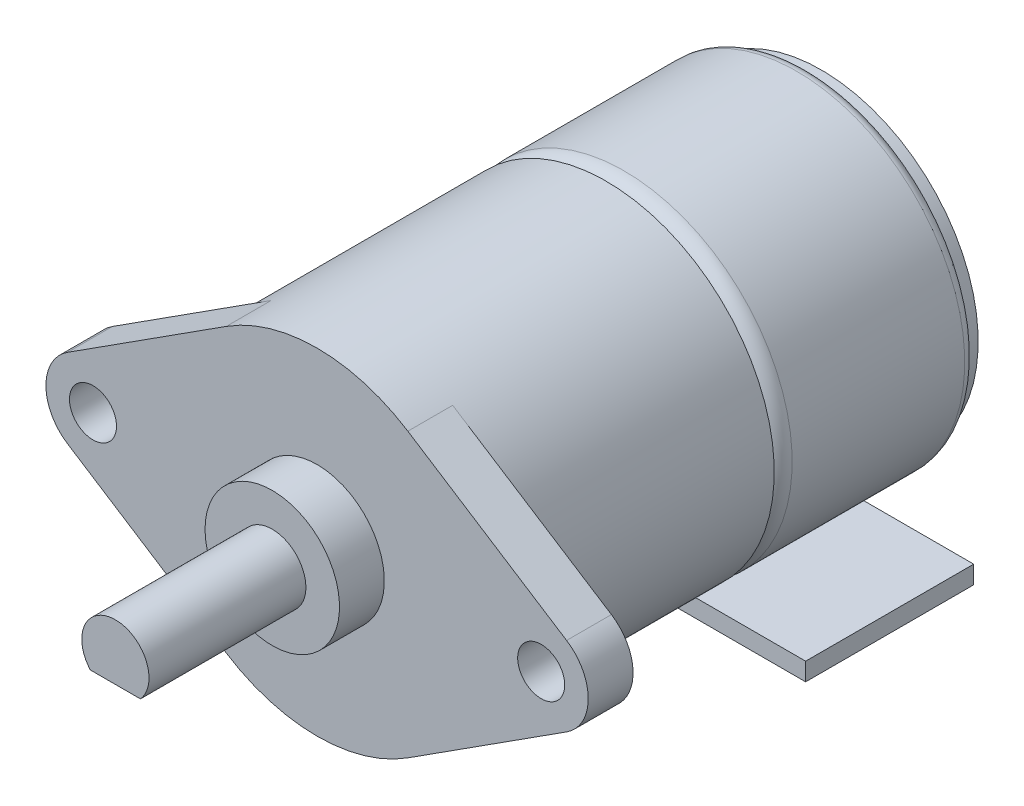
from build123d import *

# Parameters (mm, degrees)
CUT_EXTRUDE_1354_DEPTH       = 6.5
SKETCH_3_R                   = 1.05
EXTRUDE_1763_DEPTH           = 2
SKETCH_4_W                   = 11.5
SKETCH_4_H                   = 7.5
EXTRUDE_2006_DEPTH           = 0.8
SKETCH_2045_R                = 0.75
EXTRUDE_2480_DEPTH           = 0.7
EXTRUDE_2480_DRAFT           = 35
EXTRUDE_2480_PROFILE_2_DEPTH = 0.7
EXTRUDE_2480_PROFILE_2_DRAFT = 35
EXTRUDE_2480_PROFILE_3_DEPTH = 0.7
EXTRUDE_2480_PROFILE_3_DRAFT = 35
EXTRUDE_2480_PROFILE_4_DEPTH = 0.7
EXTRUDE_2480_PROFILE_4_DRAFT = 35
EXTRUDE_2480_PROFILE_5_DEPTH = 0.7
EXTRUDE_2480_PROFILE_5_DRAFT = 35
EXTRUDE_2480_PROFILE_6_DEPTH = 0.7
EXTRUDE_2480_PROFILE_6_DRAFT = 35
EXTRUDE_2480_PROFILE_7_DEPTH = 0.7
EXTRUDE_2480_PROFILE_7_DRAFT = 35
EXTRUDE_2480_PROFILE_8_DEPTH = 0.7
EXTRUDE_2480_PROFILE_8_DRAFT = 35
EXTRUDE_2791_DEPTH           = 0.01


with BuildPart() as part:
    # Эскиз1 → Motor (revolve)
    with BuildSketch(Plane(origin=(0, 0, 0), x_dir=(1, 0, 0), z_dir=(0, 1, 0))):
        with BuildLine():
            Line((-0.75, -0.5), (-3, -0.5))
            Line((-3, -0.5), (-3, -1.5))
            Line((-3, -1.5), (-7, -1.5))
            Line((-7, -1.5), (-7, -2.1))
            ThreePointArc((-7, -2.1), (-7.353553391, -2.246446609), (-7.5, -2.6))
            Line((-7.5, -2.6), (-7.5, -10.3))
            ThreePointArc((-7.5, -10.3), (-7.265685425, -10.865685425), (-6.7, -11.1))
            Line((-6.7, -11.1), (-7.5, -11.1))
            Line((-7.5, -11.1), (-7.5, -24))
            Line((-7.5, -24), (-3, -24))
            Line((-3, -24), (-3, -26))
            Line((-3, -26), (-1.5, -26))
            Line((-1.5, -26), (-1.5, -33))
            Line((-1.5, -33), (0, -33))
            Line((0, -33), (0, -12))
            Line((0, -12), (0, 0))
            Line((0, 0), (-0.5, 0))
            ThreePointArc((-0.5, 0), (-0.676776695, -0.073223305), (-0.75, -0.25))
            Line((-0.75, -0.25), (-0.75, -0.5))
        make_face()
    revolve(axis=Axis((0, 0, 0), (0, 0, 1)))

    # Эскиз2 → Cut-Extrude 1354 (cut)
    with BuildSketch(Plane.XY.offset(33)):
        with BuildLine():
            Line((-1.5, -2), (1.5, -2))
            ThreePointArc((1.5, -2), (0, 2.5), (-1.5, -2))
        make_face()
        with BuildLine():
            Line((-1.118033989, -1), (1.118033989, -1))
            ThreePointArc((1.118033989, -1), (0, 1.5), (-1.118033989, -1))
        make_face(mode=Mode.SUBTRACT)
    extrude(amount=-CUT_EXTRUDE_1354_DEPTH, mode=Mode.SUBTRACT)

    # Эскиз3 → Extrude 1763 (add)
    with BuildSketch(Plane.XY.offset(24)):
        with BuildLine():
            Line((4.05, 6.312487624), (11.134, 1.767496535))
            ThreePointArc((11.134, 1.767496535), (12.1, 0), (11.134, -1.767496535))
            Line((11.134, -1.767496535), (4.05, -6.312487624))
            ThreePointArc((4.05, -6.312487624), (0, -7.5), (-4.05, -6.312487624))
            Line((-4.05, -6.312487624), (-11.134, -1.767496535))
            ThreePointArc((-11.134, -1.767496535), (-12.1, 0), (-11.134, 1.767496535))
            Line((-11.134, 1.767496535), (-4.05, 6.312487624))
            ThreePointArc((-4.05, 6.312487624), (0, 7.5), (4.05, 6.312487624))
        make_face()
        with Locations((10, 0)):
            Circle(SKETCH_3_R, mode=Mode.SUBTRACT)
        with Locations((-10, 0)):
            Circle(SKETCH_3_R, mode=Mode.SUBTRACT)
    extrude(amount=-EXTRUDE_1763_DEPTH)


with BuildPart() as body_2:
    # Эскиз4 → Extrude 2006 (new body)
    with BuildSketch(Plane(origin=(0, -7.5, 0), x_dir=(-1, 0, 0), z_dir=(0, -1, 0))):
        with Locations((-2.25, -6.45)):
            Rectangle(SKETCH_4_W, SKETCH_4_H)
    extrude(amount=EXTRUDE_2006_DEPTH)


with BuildPart() as extrude_2480_tool:
    # Sketch 2045 → Extrude 2480 (with draft: the straight prism first)
    with BuildSketch(Plane.XZ.offset(8.3)):
        with Locations((-2.25, 5.7)):
            Circle(SKETCH_2045_R)
    extrude(amount=EXTRUDE_2480_DEPTH)
    # Extrude 2480: the draft: its side faces are tilted about the plane it starts from
    extrude_2480_sides = [extrude_2480_tool.faces().sort_by_distance(p)[0] for p in [
        (-3, -8.65, 5.7),
    ]]
    draft(extrude_2480_sides, Plane.XZ.offset(8.3), EXTRUDE_2480_DRAFT)


with BuildPart() as body_2_1:
    add(body_2.part)

    # Extrude 2480: add extrude_2480_tool
    add(extrude_2480_tool.part)


with BuildPart() as extrude_2480_profile_2_tool:
    # Sketch 2045 → Extrude 2480 profile 2 (with draft: the straight prism first)
    with BuildSketch(Plane.XZ.offset(8.3)):
        with Locations((-0.75, 7.2)):
            Circle(SKETCH_2045_R)
    extrude(amount=EXTRUDE_2480_PROFILE_2_DEPTH)
    # Extrude 2480 profile 2: the draft: its side faces are tilted about the plane it starts from
    extrude_2480_profile_2_sides = [extrude_2480_profile_2_tool.faces().sort_by_distance(p)[0] for p in [
        (-1.5, -8.65, 7.2),
    ]]
    draft(extrude_2480_profile_2_sides, Plane.XZ.offset(8.3), EXTRUDE_2480_PROFILE_2_DRAFT)


with BuildPart() as body_2_2:
    add(body_2_1.part)

    # Extrude 2480 profile 2: add extrude_2480_profile_2_tool
    add(extrude_2480_profile_2_tool.part)


with BuildPart() as extrude_2480_profile_3_tool:
    # Sketch 2045 → Extrude 2480 profile 3 (with draft: the straight prism first)
    with BuildSketch(Plane.XZ.offset(8.3)):
        with Locations((0.75, 5.7)):
            Circle(SKETCH_2045_R)
    extrude(amount=EXTRUDE_2480_PROFILE_3_DEPTH)
    # Extrude 2480 profile 3: the draft: its side faces are tilted about the plane it starts from
    extrude_2480_profile_3_sides = [extrude_2480_profile_3_tool.faces().sort_by_distance(p)[0] for p in [
        (0, -8.65, 5.7),
    ]]
    draft(extrude_2480_profile_3_sides, Plane.XZ.offset(8.3), EXTRUDE_2480_PROFILE_3_DRAFT)


with BuildPart() as body_2_3:
    add(body_2_2.part)

    # Extrude 2480 profile 3: add extrude_2480_profile_3_tool
    add(extrude_2480_profile_3_tool.part)


with BuildPart() as extrude_2480_profile_4_tool:
    # Sketch 2045 → Extrude 2480 profile 4 (with draft: the straight prism first)
    with BuildSketch(Plane.XZ.offset(8.3)):
        with Locations((2.25, 7.2)):
            Circle(SKETCH_2045_R)
    extrude(amount=EXTRUDE_2480_PROFILE_4_DEPTH)
    # Extrude 2480 profile 4: the draft: its side faces are tilted about the plane it starts from
    extrude_2480_profile_4_sides = [extrude_2480_profile_4_tool.faces().sort_by_distance(p)[0] for p in [
        (1.5, -8.65, 7.2),
    ]]
    draft(extrude_2480_profile_4_sides, Plane.XZ.offset(8.3), EXTRUDE_2480_PROFILE_4_DRAFT)


with BuildPart() as body_2_4:
    add(body_2_3.part)

    # Extrude 2480 profile 4: add extrude_2480_profile_4_tool
    add(extrude_2480_profile_4_tool.part)


with BuildPart() as extrude_2480_profile_5_tool:
    # Sketch 2045 → Extrude 2480 profile 5 (with draft: the straight prism first)
    with BuildSketch(Plane.XZ.offset(8.3)):
        with Locations((7, 3.7)):
            Circle(SKETCH_2045_R)
    extrude(amount=EXTRUDE_2480_PROFILE_5_DEPTH)
    # Extrude 2480 profile 5: the draft: its side faces are tilted about the plane it starts from
    extrude_2480_profile_5_sides = [extrude_2480_profile_5_tool.faces().sort_by_distance(p)[0] for p in [
        (6.25, -8.65, 3.7),
    ]]
    draft(extrude_2480_profile_5_sides, Plane.XZ.offset(8.3), EXTRUDE_2480_PROFILE_5_DRAFT)


with BuildPart() as body_2_5:
    add(body_2_4.part)

    # Extrude 2480 profile 5: add extrude_2480_profile_5_tool
    add(extrude_2480_profile_5_tool.part)


with BuildPart() as extrude_2480_profile_6_tool:
    # Sketch 2045 → Extrude 2480 profile 6 (with draft: the straight prism first)
    with BuildSketch(Plane.XZ.offset(8.3)):
        with Locations((7, 5.533333333)):
            Circle(SKETCH_2045_R)
    extrude(amount=EXTRUDE_2480_PROFILE_6_DEPTH)
    # Extrude 2480 profile 6: the draft: its side faces are tilted about the plane it starts from
    extrude_2480_profile_6_sides = [extrude_2480_profile_6_tool.faces().sort_by_distance(p)[0] for p in [
        (6.25, -8.65, 5.533333333),
    ]]
    draft(extrude_2480_profile_6_sides, Plane.XZ.offset(8.3), EXTRUDE_2480_PROFILE_6_DRAFT)


with BuildPart() as body_2_6:
    add(body_2_5.part)

    # Extrude 2480 profile 6: add extrude_2480_profile_6_tool
    add(extrude_2480_profile_6_tool.part)


with BuildPart() as extrude_2480_profile_7_tool:
    # Sketch 2045 → Extrude 2480 profile 7 (with draft: the straight prism first)
    with BuildSketch(Plane.XZ.offset(8.3)):
        with Locations((7, 7.366666667)):
            Circle(SKETCH_2045_R)
    extrude(amount=EXTRUDE_2480_PROFILE_7_DEPTH)
    # Extrude 2480 profile 7: the draft: its side faces are tilted about the plane it starts from
    extrude_2480_profile_7_sides = [extrude_2480_profile_7_tool.faces().sort_by_distance(p)[0] for p in [
        (6.25, -8.65, 7.366666667),
    ]]
    draft(extrude_2480_profile_7_sides, Plane.XZ.offset(8.3), EXTRUDE_2480_PROFILE_7_DRAFT)


with BuildPart() as body_2_7:
    add(body_2_6.part)

    # Extrude 2480 profile 7: add extrude_2480_profile_7_tool
    add(extrude_2480_profile_7_tool.part)


with BuildPart() as extrude_2480_profile_8_tool:
    # Sketch 2045 → Extrude 2480 profile 8 (with draft: the straight prism first)
    with BuildSketch(Plane.XZ.offset(8.3)):
        with Locations((7, 9.2)):
            Circle(SKETCH_2045_R)
    extrude(amount=EXTRUDE_2480_PROFILE_8_DEPTH)
    # Extrude 2480 profile 8: the draft: its side faces are tilted about the plane it starts from
    extrude_2480_profile_8_sides = [extrude_2480_profile_8_tool.faces().sort_by_distance(p)[0] for p in [
        (6.25, -8.65, 9.2),
    ]]
    draft(extrude_2480_profile_8_sides, Plane.XZ.offset(8.3), EXTRUDE_2480_PROFILE_8_DRAFT)


with BuildPart() as body_2_8:
    add(body_2_7.part)

    # Extrude 2480 profile 8: add extrude_2480_profile_8_tool
    add(extrude_2480_profile_8_tool.part)

    # Эскиз6 → Extrude 2791 (add)
    # profile 1 of 16: a face of its own
    with BuildSketch(Plane.XZ.offset(8.3)):
        with BuildLine():
            Line((5.183226347, 9.305128205), (5.183226347, 9.228846154))
            add(Edge.make_bspline(
                [(5.183226347, 9.228846154), (5.173106274, 9.22934332), (5.153230721, 9.23031974), (5.124252058, 9.234892324), (5.096553035, 9.241435109), (5.070356056, 9.250685891), (5.045429488, 9.262174558), (5.021872342, 9.27595185), (4.999774482, 9.292270357), (4.979340763, 9.310777707), (4.96059521, 9.330878662), (4.944407508, 9.352567247), (4.930730359, 9.375358182), (4.919296343, 9.399182322), (4.910713809, 9.424308459), (4.904345697, 9.450508582), (4.900514298, 9.4778978), (4.900102465, 9.496558949), (4.899893013, 9.506049679)],
                knots=[0, 0, 0, 0, 1.10065271, 2.161652631, 3.183658789, 4.190468796, 5.17591951, 6.163126047, 7.15150782, 8.156236427, 9.156009102, 10.134482811, 11.092018607, 12.041330605, 13.001268258, 13.972401359, 14.968799086, 16, 16, 16, 16], degree=3))
            add(Edge.make_bspline(
                [(4.899893013, 9.506049679), (4.900109439, 9.515370725), (4.900534708, 9.533686246), (4.904241722, 9.560406313), (4.909922389, 9.585903666), (4.918340243, 9.609889343), (4.928902809, 9.632609504), (4.942038744, 9.653782836), (4.957126498, 9.673921332), (4.974923245, 9.69203663), (4.993912419, 9.708677717), (5.014192696, 9.723021328), (5.035163128, 9.735374158), (5.056987523, 9.745484564), (5.079736952, 9.753148701), (5.10319331, 9.758827092), (5.127627297, 9.762073168), (5.144167936, 9.762568621), (5.152577308, 9.762820513)],
                knots=[0, 0, 0, 0, 1.111674182, 2.184400057, 3.212814286, 4.223731311, 5.211378316, 6.196328225, 7.191884489, 8.207283132, 9.220262353, 10.201199469, 11.166417575, 12.120932471, 13.06540007, 14.026332106, 14.996573967, 16, 16, 16, 16], degree=3))
            add(Edge.make_bspline(
                [(5.152577308, 9.762820513), (5.164416063, 9.762409285), (5.187885819, 9.761594047), (5.222375218, 9.75462065), (5.255790478, 9.743728994), (5.282684739, 9.730616512), (5.304353679, 9.717384889), (5.322203622, 9.705473201), (5.341418154, 9.691449296), (5.362075046, 9.675432988), (5.383903778, 9.657148454), (5.407349714, 9.637070722), (5.431979324, 9.614681279), (5.448812639, 9.598980897), (5.457535241, 9.590845353)],
                knots=[0, 0, 0, 0, 1.184416499, 2.348048165, 3.509039915, 4.696071444, 5.333504901, 6.05069495, 6.844171097, 7.714965912, 8.667477798, 9.695072654, 10.805644396, 12, 12, 12, 12], degree=3))
            Line((5.457535241, 9.590845353), (5.684508398, 9.37817508))
            Line((5.684508398, 9.37817508), (5.684508398, 9.773717949))
            Line((5.684508398, 9.773717949), (5.771687885, 9.773717949))
            Line((5.771687885, 9.773717949), (5.771687885, 9.196153846))
            Line((5.771687885, 9.196153846), (5.419905033, 9.525801282))
            add(Edge.make_bspline(
                [(5.419905033, 9.525801282), (5.411526873, 9.533827197), (5.395434141, 9.549243338), (5.371939423, 9.571047678), (5.350143106, 9.590631433), (5.330086372, 9.608121371), (5.311475849, 9.623138079), (5.294914278, 9.636464193), (5.279673911, 9.647141551), (5.262008334, 9.658729575), (5.240439628, 9.669952971), (5.214081446, 9.6795974), (5.186947685, 9.685478149), (5.168611476, 9.686183609), (5.159388206, 9.686538462)],
                knots=[0, 0, 0, 0, 1.329631726, 2.553950428, 3.673215718, 4.687767853, 5.603093632, 6.413772471, 7.123043292, 7.734684054, 8.834405432, 9.900288307, 10.943827018, 12, 12, 12, 12], degree=3))
            add(Edge.make_bspline(
                [(5.159388206, 9.686538462), (5.153588438, 9.686384067), (5.142158208, 9.686079785), (5.125399667, 9.683394344), (5.109233926, 9.679336078), (5.093611262, 9.673520801), (5.078688746, 9.665844879), (5.064448215, 9.656501344), (5.050680895, 9.6457209), (5.037772237, 9.633249877), (5.025949658, 9.619549937), (5.015476666, 9.605077047), (5.006724311, 9.589764879), (4.999549462, 9.573677992), (4.993921155, 9.556861236), (4.990021214, 9.539282083), (4.987572611, 9.520989108), (4.987241312, 9.508498116), (4.987072501, 9.502133413)],
                knots=[0, 0, 0, 0, 0.991446411, 1.95395049, 2.89581595, 3.838931463, 4.798493298, 5.75982156, 6.748411868, 7.785213223, 8.824556874, 9.840280684, 10.836137867, 11.835679398, 12.848801643, 13.863922112, 14.911575587, 16, 16, 16, 16], degree=3))
            add(Edge.make_bspline(
                [(4.987072501, 9.502133413), (4.987239299, 9.495484543), (4.987566864, 9.482427259), (4.990048006, 9.463296967), (4.993809418, 9.444921487), (4.999783361, 9.427574998), (5.006841872, 9.410881872), (5.015808949, 9.395198482), (5.026228891, 9.380264435), (5.03831124, 9.366325367), (5.051886632, 9.353594562), (5.066847651, 9.342251598), (5.08308659, 9.332405907), (5.1005368, 9.323803635), (5.119372022, 9.316820921), (5.139521114, 9.311484355), (5.160897794, 9.307261899), (5.175659878, 9.305851249), (5.183226347, 9.305128205)],
                knots=[0, 0, 0, 0, 1.030878251, 2.024474673, 2.987898669, 3.934362936, 4.864849709, 5.795128259, 6.730474222, 7.685293701, 8.650606017, 9.611896181, 10.591709709, 11.591680886, 12.625074257, 13.701333388, 14.821793024, 16, 16, 16, 16], degree=3))
        make_face()
    # profile 2 of 16: a face of its own
    with BuildSketch(Plane.XZ.offset(8.3)):
        Polygon((4.921687885, 8.749358974), (5.771687885, 9.141666667), (5.771687885, 9.05874399), (5.499251988, 8.933082933), (5.499251988, 8.54775641), (5.771687885, 8.418519631), (5.771687885, 8.33525641), (4.921687885, 8.738461538), align=None)
        Polygon((5.087362965, 8.743058894), (5.412072501, 8.589132612), (5.412072501, 8.892898638), align=None, mode=Mode.SUBTRACT)
    # profile 3 of 16: a face of its own
    with BuildSketch(Plane.XZ.offset(8.3)):
        Polygon((4.921687885, 7.524248798), (4.921687885, 7.681410256), (5.771687885, 7.681410256), (5.771687885, 7.605128205), (5.008867372, 7.605128205), (5.008867372, 7.474358974), align=None)
    # profile 4 of 16: a face of its own
    with BuildSketch(Plane.XZ.offset(8.3)):
        Polygon((4.921687885, 6.896794872), (5.771687885, 7.289102564), (5.771687885, 7.206179888), (5.499251988, 7.08051883), (5.499251988, 6.695192308), (5.771687885, 6.565955529), (5.771687885, 6.482692308), (4.921687885, 6.885897436), align=None)
        Polygon((5.087362965, 6.890494792), (5.412072501, 6.73656851), (5.412072501, 7.040334535), align=None, mode=Mode.SUBTRACT)
    # profile 5 of 16: a face of its own
    with BuildSketch(Plane.XZ.offset(8.3)):
        with BuildLine():
            Line((5.183226347, 5.6), (5.183226347, 5.523717949))
            add(Edge.make_bspline(
                [(5.183226347, 5.523717949), (5.173106274, 5.524215114), (5.153230721, 5.525191535), (5.124252058, 5.529764119), (5.096553035, 5.536306904), (5.070356056, 5.545557685), (5.045429488, 5.557046353), (5.021872342, 5.570823645), (4.999774482, 5.587142152), (4.979340763, 5.605649501), (4.96059521, 5.625750457), (4.944407508, 5.647439042), (4.930730359, 5.670229977), (4.919296343, 5.694054117), (4.910713809, 5.719180254), (4.904345697, 5.745380376), (4.900514298, 5.772769595), (4.900102465, 5.791430743), (4.899893013, 5.800921474)],
                knots=[0, 0, 0, 0, 1.10065271, 2.161652631, 3.183658789, 4.190468796, 5.17591951, 6.163126047, 7.15150782, 8.156236427, 9.156009102, 10.134482811, 11.092018607, 12.041330605, 13.001268258, 13.972401359, 14.968799086, 16, 16, 16, 16], degree=3))
            add(Edge.make_bspline(
                [(4.899893013, 5.800921474), (4.900109439, 5.81024252), (4.900534708, 5.828558041), (4.904241722, 5.855278108), (4.909922389, 5.880775461), (4.918340243, 5.904761137), (4.928902809, 5.927481298), (4.942038744, 5.94865463), (4.957126498, 5.968793127), (4.974923245, 5.986908425), (4.993912419, 6.003549512), (5.014192696, 6.017893123), (5.035163128, 6.030245953), (5.056987523, 6.040356359), (5.079736952, 6.048020496), (5.10319331, 6.053698887), (5.127627297, 6.056944963), (5.144167936, 6.057440416), (5.152577308, 6.057692308)],
                knots=[0, 0, 0, 0, 1.111674182, 2.184400057, 3.212814286, 4.223731311, 5.211378316, 6.196328225, 7.191884489, 8.207283132, 9.220262353, 10.201199469, 11.166417575, 12.120932471, 13.06540007, 14.026332106, 14.996573967, 16, 16, 16, 16], degree=3))
            add(Edge.make_bspline(
                [(5.152577308, 6.057692308), (5.164416063, 6.05728108), (5.187885819, 6.056465842), (5.222375218, 6.049492445), (5.255790478, 6.038600789), (5.282684739, 6.025488307), (5.304353679, 6.012256684), (5.322203622, 6.000344996), (5.341418154, 5.986321091), (5.362075046, 5.970304783), (5.383903778, 5.952020248), (5.407349714, 5.931942517), (5.431979324, 5.909553074), (5.448812639, 5.893852692), (5.457535241, 5.885717147)],
                knots=[0, 0, 0, 0, 1.184416499, 2.348048165, 3.509039915, 4.696071444, 5.333504901, 6.05069495, 6.844171097, 7.714965912, 8.667477798, 9.695072654, 10.805644396, 12, 12, 12, 12], degree=3))
            Line((5.457535241, 5.885717147), (5.684508398, 5.673046875))
            Line((5.684508398, 5.673046875), (5.684508398, 6.068589744))
            Line((5.684508398, 6.068589744), (5.771687885, 6.068589744))
            Line((5.771687885, 6.068589744), (5.771687885, 5.491025641))
            Line((5.771687885, 5.491025641), (5.419905033, 5.820673077))
            add(Edge.make_bspline(
                [(5.419905033, 5.820673077), (5.411526873, 5.828698992), (5.395434141, 5.844115133), (5.371939423, 5.865919473), (5.350143106, 5.885503228), (5.330086372, 5.902993166), (5.311475849, 5.918009874), (5.294914278, 5.931335988), (5.279673911, 5.942013346), (5.262008334, 5.95360137), (5.240439628, 5.964824766), (5.214081446, 5.974469195), (5.186947685, 5.980349944), (5.168611476, 5.981055404), (5.159388206, 5.981410256)],
                knots=[0, 0, 0, 0, 1.329631726, 2.553950428, 3.673215718, 4.687767853, 5.603093632, 6.413772471, 7.123043292, 7.734684054, 8.834405432, 9.900288307, 10.943827018, 12, 12, 12, 12], degree=3))
            add(Edge.make_bspline(
                [(5.159388206, 5.981410256), (5.153588438, 5.981255862), (5.142158208, 5.98095158), (5.125399667, 5.978266139), (5.109233926, 5.974207873), (5.093611262, 5.968392596), (5.078688746, 5.960716674), (5.064448215, 5.951373139), (5.050680895, 5.940592695), (5.037772237, 5.928121672), (5.025949658, 5.914421732), (5.015476666, 5.899948842), (5.006724311, 5.884636674), (4.999549462, 5.868549787), (4.993921155, 5.85173303), (4.990021214, 5.834153878), (4.987572611, 5.815860903), (4.987241312, 5.803369911), (4.987072501, 5.797005208)],
                knots=[0, 0, 0, 0, 0.991446411, 1.95395049, 2.89581595, 3.838931463, 4.798493298, 5.75982156, 6.748411868, 7.785213223, 8.824556874, 9.840280684, 10.836137867, 11.835679398, 12.848801643, 13.863922112, 14.911575587, 16, 16, 16, 16], degree=3))
            add(Edge.make_bspline(
                [(4.987072501, 5.797005208), (4.987239299, 5.790356338), (4.987566864, 5.777299054), (4.990048006, 5.758168762), (4.993809418, 5.739793282), (4.999783361, 5.722446793), (5.006841872, 5.705753667), (5.015808949, 5.690070277), (5.026228891, 5.67513623), (5.03831124, 5.661197162), (5.051886632, 5.648466356), (5.066847651, 5.637123393), (5.08308659, 5.627277702), (5.1005368, 5.61867543), (5.119372022, 5.611692716), (5.139521114, 5.606356149), (5.160897794, 5.602133694), (5.175659878, 5.600723044), (5.183226347, 5.6)],
                knots=[0, 0, 0, 0, 1.030878251, 2.024474673, 2.987898669, 3.934362936, 4.864849709, 5.795128259, 6.730474222, 7.685293701, 8.650606017, 9.611896181, 10.591709709, 11.591680886, 12.625074257, 13.701333388, 14.821793024, 16, 16, 16, 16], degree=3))
        make_face()
    # profile 6 of 16: a face of its own
    with BuildSketch(Plane.XZ.offset(8.3)):
        with BuildLine():
            Line((4.921687885, 4.891666667), (4.921687885, 5.057512019))
            add(Edge.make_bspline(
                [(4.921687885, 5.057512019), (4.921729896, 5.065630492), (4.921811322, 5.081366113), (4.9231035, 5.104246237), (4.924821328, 5.125684119), (4.927702893, 5.145641874), (4.930690696, 5.164249365), (4.935076075, 5.181317687), (4.939919886, 5.196989808), (4.947372746, 5.215808817), (4.958947132, 5.237161562), (4.976113047, 5.260111768), (4.996693592, 5.280061486), (5.020146747, 5.297024661), (5.045947875, 5.310637969), (5.073541857, 5.320362002), (5.102464456, 5.326609091), (5.122293572, 5.327243488), (5.132314888, 5.327564103)],
                knots=[0, 0, 0, 0, 1.00128172, 1.940733171, 2.826250472, 3.653024905, 4.427672124, 5.149348099, 5.824709082, 6.450061444, 7.643590664, 8.808605388, 9.972104426, 11.165284501, 12.367876273, 13.557044126, 14.765369432, 16, 16, 16, 16], degree=3))
            add(Edge.make_bspline(
                [(5.132314888, 5.327564103), (5.141701525, 5.327297054), (5.160147151, 5.326772279), (5.187079484, 5.321815329), (5.212690558, 5.313947941), (5.236958454, 5.303074894), (5.259431423, 5.28906558), (5.28003985, 5.272280453), (5.29800485, 5.252113258), (5.308044519, 5.23699586), (5.313144215, 5.229316907)],
                knots=[0, 0, 0, 0, 1.044641374, 2.052818814, 3.038628718, 4.023282556, 5.005660861, 5.98021751, 6.974042014, 8, 8, 8, 8], degree=3))
            add(Edge.make_bspline(
                [(5.313144215, 5.229316907), (5.31685263, 5.238972078), (5.323947745, 5.257444813), (5.336472213, 5.282880656), (5.350143866, 5.304715331), (5.364843335, 5.323375369), (5.380921481, 5.33925023), (5.39850893, 5.352998779), (5.417591286, 5.364884666), (5.438098413, 5.374999475), (5.459856464, 5.382944783), (5.482599686, 5.388784474), (5.506240892, 5.392238779), (5.522284288, 5.392709999), (5.530411844, 5.392948718)],
                knots=[0, 0, 0, 0, 1.272586185, 2.434772614, 3.483318042, 4.437947805, 5.351807173, 6.25737843, 7.180033415, 8.1141739, 9.066731021, 10.025721652, 10.999834114, 12, 12, 12, 12], degree=3))
            add(Edge.make_bspline(
                [(5.530411844, 5.392948718), (5.538709546, 5.392711536), (5.555035509, 5.392244873), (5.579018416, 5.388800425), (5.601939819, 5.382972364), (5.623937413, 5.374930785), (5.644965078, 5.36450756), (5.664946637, 5.351639506), (5.683923663, 5.336507263), (5.701929646, 5.319405383), (5.718405686, 5.300346676), (5.732569525, 5.279342753), (5.744748407, 5.256969021), (5.754664019, 5.232939453), (5.762313907, 5.20731539), (5.767643775, 5.180111092), (5.771241058, 5.151371361), (5.771536416, 5.131648848), (5.771687885, 5.121534455)],
                knots=[0, 0, 0, 0, 0.978680899, 1.925582087, 2.851223405, 3.764209995, 4.683484765, 5.614004905, 6.562443559, 7.542772147, 8.539900013, 9.527881485, 10.525548727, 11.540192123, 12.58875426, 13.674701727, 14.807505862, 16, 16, 16, 16], degree=3))
            Line((5.771687885, 5.121534455), (5.771687885, 4.891666667))
            Line((5.771687885, 4.891666667), (4.921687885, 4.891666667))
        make_face()
        with BuildLine():
            Line((5.008867372, 4.967948718), (5.28130327, 4.967948718))
            Line((5.28130327, 4.967948718), (5.28130327, 5.019200721))
            add(Edge.make_bspline(
                [(5.28130327, 5.019200721), (5.281206146, 5.026692571), (5.281018482, 5.041168353), (5.280480913, 5.062131756), (5.278975675, 5.08159069), (5.277470866, 5.099511561), (5.275024188, 5.115866163), (5.272111792, 5.130618217), (5.269031732, 5.14399939), (5.263793117, 5.159430062), (5.256053503, 5.176935943), (5.244030592, 5.195585728), (5.22972181, 5.212103369), (5.213057021, 5.225884323), (5.194906136, 5.237262557), (5.175428501, 5.245233368), (5.155016081, 5.250547271), (5.140975869, 5.251034615), (5.13384734, 5.251282051)],
                knots=[0, 0, 0, 0, 1.156917035, 2.235399477, 3.236897345, 4.169954739, 5.01148057, 5.788325709, 6.491867502, 7.129259015, 8.302032419, 9.437271567, 10.542795419, 11.662606952, 12.764338259, 13.836858145, 14.901724648, 16, 16, 16, 16], degree=3))
            add(Edge.make_bspline(
                [(5.13384734, 5.251282051), (5.129129035, 5.251156419), (5.119873562, 5.250909976), (5.106337387, 5.248818291), (5.093618347, 5.245429205), (5.081594372, 5.240839469), (5.070564286, 5.234569208), (5.060001043, 5.227301152), (5.05053733, 5.218327706), (5.041717527, 5.208186914), (5.033823833, 5.19658404), (5.027285131, 5.183269099), (5.021358894, 5.168586302), (5.016971877, 5.152137298), (5.013114184, 5.134262916), (5.010690369, 5.114721129), (5.009130621, 5.09363577), (5.008957079, 5.079026264), (5.008867372, 5.071474359)],
                knots=[0, 0, 0, 0, 0.911708768, 1.788416306, 2.640049961, 3.452993646, 4.268229297, 5.087074648, 5.92553149, 6.781184137, 7.681934069, 8.628939405, 9.643570426, 10.73771997, 11.914765019, 13.176320755, 14.540391495, 16, 16, 16, 16], degree=3))
            Line((5.008867372, 5.071474359), (5.008867372, 4.967948718))
        make_face(mode=Mode.SUBTRACT)
        with BuildLine():
            Line((5.368482757, 4.967948718), (5.684508398, 4.967948718))
            Line((5.684508398, 4.967948718), (5.684508398, 5.076582532))
            add(Edge.make_bspline(
                [(5.684508398, 5.076582532), (5.684405935, 5.084357744), (5.684208452, 5.099343439), (5.683745313, 5.120997247), (5.681993329, 5.141014608), (5.680377131, 5.159458668), (5.677613502, 5.176280477), (5.675005355, 5.19160943), (5.671133746, 5.20519389), (5.665812676, 5.221090852), (5.657294304, 5.23885998), (5.644849042, 5.25827844), (5.629489668, 5.275211035), (5.612021289, 5.289746088), (5.593080235, 5.301741044), (5.572914124, 5.31034856), (5.55191515, 5.315697578), (5.537594042, 5.316342987), (5.530411844, 5.316666667)],
                knots=[0, 0, 0, 0, 1.160376723, 2.23647316, 3.230273494, 4.158083346, 4.997711197, 5.773399541, 6.476071462, 7.102777513, 8.27340052, 9.405620712, 10.53304798, 11.669441455, 12.787990954, 13.865552736, 14.929550474, 16, 16, 16, 16], degree=3))
            add(Edge.make_bspline(
                [(5.530411844, 5.316666667), (5.525920507, 5.316599818), (5.51701028, 5.316467199), (5.503917848, 5.314458056), (5.491229211, 5.311551463), (5.478891494, 5.307723396), (5.467112139, 5.302371964), (5.455845971, 5.295811558), (5.444866039, 5.288302007), (5.430805284, 5.276716191), (5.414806095, 5.259618481), (5.39933539, 5.235320728), (5.386657297, 5.207845865), (5.381297542, 5.187872045), (5.378528831, 5.177554087)],
                knots=[0, 0, 0, 0, 0.723302347, 1.434937762, 2.129609326, 2.821140842, 3.513216847, 4.209993937, 4.920569932, 5.655069131, 7.14393391, 8.6716197, 10.280644748, 12, 12, 12, 12], degree=3))
            add(Edge.make_bspline(
                [(5.378528831, 5.177554087), (5.377689739, 5.173418449), (5.375870415, 5.164451534), (5.373949973, 5.149829693), (5.372239029, 5.133136696), (5.370973463, 5.114333997), (5.369665302, 5.093397807), (5.36915656, 5.070283413), (5.368549597, 5.045085208), (5.368505607, 5.027601346), (5.368482757, 5.018519631)],
                knots=[0, 0, 0, 0, 0.634451884, 1.375622551, 2.216452059, 3.157844607, 4.20941857, 5.370758133, 6.634282058, 8, 8, 8, 8], degree=3))
            Line((5.368482757, 5.018519631), (5.368482757, 4.967948718))
        make_face(mode=Mode.SUBTRACT)
    # profile 7 of 16: a face of its own
    with BuildSketch(Plane.XZ.offset(8.3)):
        Polygon((4.921687885, 4.015274439), (4.921687885, 4.172435897), (5.771687885, 4.172435897), (5.771687885, 4.096153846), (5.008867372, 4.096153846), (5.008867372, 3.965384615), align=None)
    # profile 8 of 16: a face of its own
    with BuildSketch(Plane.XZ.offset(8.3)):
        with BuildLine():
            Line((4.921687885, 3.23525641), (4.921687885, 3.401101763))
            add(Edge.make_bspline(
                [(4.921687885, 3.401101763), (4.921729896, 3.409220236), (4.921811322, 3.424955856), (4.9231035, 3.447835981), (4.924821328, 3.469273862), (4.927702893, 3.489231618), (4.930690696, 3.507839109), (4.935076075, 3.52490743), (4.939919886, 3.540579551), (4.947372746, 3.559398561), (4.958947132, 3.580751306), (4.976113047, 3.603701511), (4.996693592, 3.62365123), (5.020146747, 3.640614404), (5.045947875, 3.654227713), (5.073541857, 3.663951745), (5.102464456, 3.670198834), (5.122293572, 3.670833232), (5.132314888, 3.671153846)],
                knots=[0, 0, 0, 0, 1.00128172, 1.940733171, 2.826250472, 3.653024905, 4.427672124, 5.149348099, 5.824709082, 6.450061444, 7.643590664, 8.808605388, 9.972104426, 11.165284501, 12.367876273, 13.557044126, 14.765369432, 16, 16, 16, 16], degree=3))
            add(Edge.make_bspline(
                [(5.132314888, 3.671153846), (5.141701525, 3.670886798), (5.160147151, 3.670362023), (5.187079484, 3.665405073), (5.212690558, 3.657537685), (5.236958454, 3.646664637), (5.259431423, 3.632655324), (5.28003985, 3.615870197), (5.29800485, 3.595703001), (5.308044519, 3.580585604), (5.313144215, 3.572906651)],
                knots=[0, 0, 0, 0, 1.044641374, 2.052818814, 3.038628718, 4.023282556, 5.005660861, 5.98021751, 6.974042014, 8, 8, 8, 8], degree=3))
            add(Edge.make_bspline(
                [(5.313144215, 3.572906651), (5.31685263, 3.582561822), (5.323947745, 3.601034557), (5.336472213, 3.626470399), (5.350143866, 3.648305075), (5.364843335, 3.666965112), (5.380921481, 3.682839974), (5.39850893, 3.696588522), (5.417591286, 3.70847441), (5.438098413, 3.718589218), (5.459856464, 3.726534527), (5.482599686, 3.732374218), (5.506240892, 3.735828522), (5.522284288, 3.736299742), (5.530411844, 3.736538462)],
                knots=[0, 0, 0, 0, 1.272586185, 2.434772614, 3.483318042, 4.437947805, 5.351807173, 6.25737843, 7.180033415, 8.1141739, 9.066731021, 10.025721652, 10.999834114, 12, 12, 12, 12], degree=3))
            add(Edge.make_bspline(
                [(5.530411844, 3.736538462), (5.538709546, 3.736301279), (5.555035509, 3.735834617), (5.579018416, 3.732390169), (5.601939819, 3.726562108), (5.623937413, 3.718520529), (5.644965078, 3.708097304), (5.664946637, 3.695229249), (5.683923663, 3.680097007), (5.701929646, 3.662995127), (5.718405686, 3.643936419), (5.732569525, 3.622932497), (5.744748407, 3.600558765), (5.754664019, 3.576529196), (5.762313907, 3.550905134), (5.767643775, 3.523700836), (5.771241058, 3.494961104), (5.771536416, 3.475238592), (5.771687885, 3.465124199)],
                knots=[0, 0, 0, 0, 0.978680899, 1.925582087, 2.851223405, 3.764209995, 4.683484765, 5.614004905, 6.562443559, 7.542772147, 8.539900013, 9.527881485, 10.525548727, 11.540192123, 12.58875426, 13.674701727, 14.807505862, 16, 16, 16, 16], degree=3))
            Line((5.771687885, 3.465124199), (5.771687885, 3.23525641))
            Line((5.771687885, 3.23525641), (4.921687885, 3.23525641))
        make_face()
        with BuildLine():
            Line((5.008867372, 3.311538462), (5.28130327, 3.311538462))
            Line((5.28130327, 3.311538462), (5.28130327, 3.362790465))
            add(Edge.make_bspline(
                [(5.28130327, 3.362790465), (5.281206146, 3.370282315), (5.281018482, 3.384758097), (5.280480913, 3.4057215), (5.278975675, 3.425180434), (5.277470866, 3.443101305), (5.275024188, 3.459455906), (5.272111792, 3.474207961), (5.269031732, 3.487589134), (5.263793117, 3.503019805), (5.256053503, 3.520525687), (5.244030592, 3.539175472), (5.22972181, 3.555693113), (5.213057021, 3.569474066), (5.194906136, 3.580852301), (5.175428501, 3.588823112), (5.155016081, 3.594137014), (5.140975869, 3.594624359), (5.13384734, 3.594871795)],
                knots=[0, 0, 0, 0, 1.156917035, 2.235399477, 3.236897345, 4.169954739, 5.01148057, 5.788325709, 6.491867502, 7.129259015, 8.302032419, 9.437271567, 10.542795419, 11.662606952, 12.764338259, 13.836858145, 14.901724648, 16, 16, 16, 16], degree=3))
            add(Edge.make_bspline(
                [(5.13384734, 3.594871795), (5.129129035, 3.594746162), (5.119873562, 3.59449972), (5.106337387, 3.592408034), (5.093618347, 3.589018948), (5.081594372, 3.584429212), (5.070564286, 3.578158952), (5.060001043, 3.570890896), (5.05053733, 3.561917449), (5.041717527, 3.551776658), (5.033823833, 3.540173783), (5.027285131, 3.526858842), (5.021358894, 3.512176046), (5.016971877, 3.495727042), (5.013114184, 3.477852659), (5.010690369, 3.458310873), (5.009130621, 3.437225513), (5.008957079, 3.422616008), (5.008867372, 3.415064103)],
                knots=[0, 0, 0, 0, 0.911708768, 1.788416306, 2.640049961, 3.452993646, 4.268229297, 5.087074648, 5.92553149, 6.781184137, 7.681934069, 8.628939405, 9.643570426, 10.73771997, 11.914765019, 13.176320755, 14.540391495, 16, 16, 16, 16], degree=3))
            Line((5.008867372, 3.415064103), (5.008867372, 3.311538462))
        make_face(mode=Mode.SUBTRACT)
        with BuildLine():
            Line((5.368482757, 3.311538462), (5.684508398, 3.311538462))
            Line((5.684508398, 3.311538462), (5.684508398, 3.420172276))
            add(Edge.make_bspline(
                [(5.684508398, 3.420172276), (5.684405935, 3.427947487), (5.684208452, 3.442933183), (5.683745313, 3.464586991), (5.681993329, 3.484604351), (5.680377131, 3.503048412), (5.677613502, 3.519870221), (5.675005355, 3.535199173), (5.671133746, 3.548783634), (5.665812676, 3.564680595), (5.657294304, 3.582449724), (5.644849042, 3.601868183), (5.629489668, 3.618800779), (5.612021289, 3.633335831), (5.593080235, 3.645330788), (5.572914124, 3.653938304), (5.55191515, 3.659287321), (5.537594042, 3.65993273), (5.530411844, 3.66025641)],
                knots=[0, 0, 0, 0, 1.160376723, 2.23647316, 3.230273494, 4.158083346, 4.997711197, 5.773399541, 6.476071462, 7.102777513, 8.27340052, 9.405620712, 10.53304798, 11.669441455, 12.787990954, 13.865552736, 14.929550474, 16, 16, 16, 16], degree=3))
            add(Edge.make_bspline(
                [(5.530411844, 3.66025641), (5.525920507, 3.660189562), (5.51701028, 3.660056943), (5.503917848, 3.6580478), (5.491229211, 3.655141206), (5.478891494, 3.651313139), (5.467112139, 3.645961708), (5.455845971, 3.639401301), (5.444866039, 3.631891751), (5.430805284, 3.620305934), (5.414806095, 3.603208225), (5.39933539, 3.578910472), (5.386657297, 3.551435609), (5.381297542, 3.531461789), (5.378528831, 3.52114383)],
                knots=[0, 0, 0, 0, 0.723302347, 1.434937762, 2.129609326, 2.821140842, 3.513216847, 4.209993937, 4.920569932, 5.655069131, 7.14393391, 8.6716197, 10.280644748, 12, 12, 12, 12], degree=3))
            add(Edge.make_bspline(
                [(5.378528831, 3.52114383), (5.377689739, 3.517008193), (5.375870415, 3.508041277), (5.373949973, 3.493419436), (5.372239029, 3.47672644), (5.370973463, 3.457923741), (5.369665302, 3.436987551), (5.36915656, 3.413873156), (5.368549597, 3.388674951), (5.368505607, 3.371191089), (5.368482757, 3.362109375)],
                knots=[0, 0, 0, 0, 0.634451884, 1.375622551, 2.216452059, 3.157844607, 4.20941857, 5.370758133, 6.634282058, 8, 8, 8, 8], degree=3))
            Line((5.368482757, 3.362109375), (5.368482757, 3.311538462))
        make_face(mode=Mode.SUBTRACT)
    # profile 9 of 16: a face of its own
    with BuildSketch(Plane.XZ.offset(8.3)):
        with BuildLine():
            Line((-3.08974359, 8.993200129), (-2.933653846, 8.993200129))
            add(Edge.make_bspline(
                [(-2.933653846, 8.993200129), (-2.926013051, 8.993159958), (-2.911203289, 8.993082095), (-2.889667416, 8.991874522), (-2.86949626, 8.990227969), (-2.850683969, 8.987615377), (-2.833239237, 8.98446297), (-2.817109491, 8.980645413), (-2.802346023, 8.976067901), (-2.784720255, 8.968788751), (-2.764624104, 8.957972027), (-2.742864471, 8.941988355), (-2.724257788, 8.922438077), (-2.708215201, 8.900384899), (-2.69546066, 8.876125294), (-2.686233392, 8.850237479), (-2.680391591, 8.823055367), (-2.679790807, 8.804394069), (-2.679487179, 8.79496295)],
                knots=[0, 0, 0, 0, 1.001505555, 1.941167018, 2.826882275, 3.653841531, 4.429895133, 5.150066043, 5.825578002, 6.45369114, 7.647487171, 8.808567382, 9.977351308, 11.170798116, 12.373658725, 13.556498008, 14.765093433, 16, 16, 16, 16], degree=3))
            add(Edge.make_bspline(
                [(-2.679487179, 8.79496295), (-2.679737058, 8.78612808), (-2.680228093, 8.768766727), (-2.684923581, 8.743373788), (-2.692274591, 8.719202081), (-2.702492933, 8.696339821), (-2.71577339, 8.675303567), (-2.731512434, 8.65592362), (-2.750501417, 8.639020522), (-2.764728443, 8.629570715), (-2.771955128, 8.624770642)],
                knots=[0, 0, 0, 0, 1.044552857, 2.05264487, 3.044412934, 4.028983338, 5.005914585, 5.980388656, 6.974128949, 8, 8, 8, 8], degree=3))
            add(Edge.make_bspline(
                [(-2.771955128, 8.624770642), (-2.76286703, 8.621281499), (-2.745479248, 8.614605905), (-2.721551017, 8.602803513), (-2.700935052, 8.58996646), (-2.683472847, 8.575947751), (-2.668538526, 8.560837166), (-2.655497854, 8.54441314), (-2.644370683, 8.526461424), (-2.6348363, 8.507169187), (-2.627396585, 8.486733423), (-2.621824949, 8.465345817), (-2.618632389, 8.443083061), (-2.618178071, 8.427932117), (-2.617948718, 8.420283462)],
                knots=[0, 0, 0, 0, 1.27268992, 2.434971085, 3.483601985, 4.442670788, 5.356604649, 6.2567628, 7.179492994, 8.113709626, 9.066344395, 10.018646069, 10.999752585, 12, 12, 12, 12], degree=3))
            add(Edge.make_bspline(
                [(-2.617948718, 8.420283462), (-2.618171997, 8.412473892), (-2.618611305, 8.397108342), (-2.621852441, 8.37453574), (-2.627340237, 8.352964324), (-2.634899356, 8.332254568), (-2.644765028, 8.312446537), (-2.65677142, 8.293517791), (-2.671087206, 8.275658515), (-2.687101576, 8.258670259), (-2.705218638, 8.243395336), (-2.724765096, 8.229791746), (-2.745987112, 8.218604075), (-2.768536139, 8.209206127), (-2.792665126, 8.202027339), (-2.818265722, 8.197005036), (-2.845315848, 8.193621027), (-2.863878077, 8.193342809), (-2.873397436, 8.193200129)],
                knots=[0, 0, 0, 0, 0.978564426, 1.925352924, 2.850884081, 3.763762016, 4.682927383, 5.618979971, 6.567305752, 7.547517671, 8.540179244, 9.531824382, 10.526200242, 11.540722885, 12.589160233, 13.674978461, 14.80764778, 16, 16, 16, 16], degree=3))
            Line((-2.873397436, 8.193200129), (-3.08974359, 8.193200129))
            Line((-3.08974359, 8.193200129), (-3.08974359, 8.993200129))
        make_face()
        with BuildLine():
            Line((-3.017948718, 8.911148847), (-3.017948718, 8.654738591))
            Line((-3.017948718, 8.654738591), (-2.969711538, 8.654738591))
            add(Edge.make_bspline(
                [(-2.969711538, 8.654738591), (-2.962660385, 8.654830002), (-2.94903612, 8.655006626), (-2.929305858, 8.655512573), (-2.910991568, 8.656929269), (-2.894124864, 8.658345557), (-2.878732305, 8.66064832), (-2.864847994, 8.663389377), (-2.852254029, 8.666288326), (-2.837730704, 8.671218495), (-2.821256887, 8.678504821), (-2.803695035, 8.689812669), (-2.78821287, 8.703281092), (-2.775139228, 8.718821884), (-2.764439463, 8.735934155), (-2.757007757, 8.75434487), (-2.751968377, 8.773595186), (-2.75151317, 8.786810787), (-2.751282051, 8.793520642)],
                knots=[0, 0, 0, 0, 1.156816544, 2.235205308, 3.236616184, 4.169592532, 5.011045266, 5.787822928, 6.49130361, 7.128639758, 8.301311294, 9.436451833, 10.541879658, 11.654887649, 12.756523258, 13.837046038, 14.901820046, 16, 16, 16, 16], degree=3))
            add(Edge.make_bspline(
                [(-2.751282051, 8.793520642), (-2.751402321, 8.797960818), (-2.751638243, 8.806670709), (-2.753570427, 8.819367704), (-2.756854444, 8.831309133), (-2.761072568, 8.842658644), (-2.766967125, 8.853061353), (-2.773907346, 8.862876941), (-2.782292646, 8.871771139), (-2.791837175, 8.880084167), (-2.802810574, 8.887454345), (-2.815206298, 8.893909377), (-2.829192053, 8.899107268), (-2.844532134, 8.903659532), (-2.861462668, 8.906856856), (-2.879788281, 8.909520488), (-2.899659073, 8.910876543), (-2.913406525, 8.911056055), (-2.920512821, 8.911148847)],
                knots=[0, 0, 0, 0, 0.91205012, 1.789085906, 2.630437955, 3.453916878, 4.269457761, 5.079663411, 5.91843418, 6.774407191, 7.675494373, 8.627863946, 9.638891023, 10.736472738, 11.911756761, 13.175263542, 14.539845004, 16, 16, 16, 16], degree=3))
            Line((-2.920512821, 8.911148847), (-3.017948718, 8.911148847))
        make_face(mode=Mode.SUBTRACT)
        with BuildLine():
            Line((-3.017948718, 8.572687309), (-3.017948718, 8.275251411))
            Line((-3.017948718, 8.275251411), (-2.915705128, 8.275251411))
            add(Edge.make_bspline(
                [(-2.915705128, 8.275251411), (-2.908386517, 8.275339125), (-2.894280857, 8.275508181), (-2.873914862, 8.27606008), (-2.855038724, 8.277315457), (-2.837738579, 8.279291651), (-2.821827618, 8.281435297), (-2.807496715, 8.284317875), (-2.794629699, 8.287620495), (-2.779709857, 8.292725448), (-2.762909055, 8.30065607), (-2.744803717, 8.312613608), (-2.728706295, 8.326858935), (-2.715036522, 8.343346001), (-2.703833553, 8.361273162), (-2.695683735, 8.380277813), (-2.690657253, 8.400045934), (-2.690048757, 8.41352404), (-2.68974359, 8.420283462)],
                knots=[0, 0, 0, 0, 1.160039823, 2.235823828, 3.228722157, 4.157150951, 4.99529583, 5.772374946, 6.472645482, 7.099169577, 8.269452708, 9.405989375, 10.527446681, 11.663510218, 12.788923519, 13.866172445, 14.929861265, 16, 16, 16, 16], degree=3))
            add(Edge.make_bspline(
                [(-2.68974359, 8.420283462), (-2.689806699, 8.424510512), (-2.6899319, 8.432896428), (-2.691820041, 8.445220043), (-2.694566068, 8.457157386), (-2.69811611, 8.468740869), (-2.703286274, 8.47976107), (-2.709322056, 8.49043594), (-2.716398948, 8.500779593), (-2.727426186, 8.513856679), (-2.743465497, 8.528923425), (-2.766255617, 8.543674854), (-2.792169285, 8.555571496), (-2.81096414, 8.560622805), (-2.820673077, 8.56323218)],
                knots=[0, 0, 0, 0, 0.723448775, 1.435228256, 2.130040452, 2.821711965, 3.505591119, 4.210454504, 4.921174351, 5.648778258, 7.137944449, 8.670945889, 10.280296675, 12, 12, 12, 12], degree=3))
            add(Edge.make_bspline(
                [(-2.820673077, 8.56323218), (-2.824565442, 8.564021914), (-2.833004891, 8.565734219), (-2.846766624, 8.567541694), (-2.86247768, 8.569151993), (-2.880174337, 8.570343115), (-2.899878987, 8.571574325), (-2.921633711, 8.572053141), (-2.945349669, 8.572624401), (-2.961805068, 8.572665803), (-2.970352564, 8.572687309)],
                knots=[0, 0, 0, 0, 0.634451884, 1.375622551, 2.216452059, 3.157844607, 4.20941857, 5.370758133, 6.634282058, 8, 8, 8, 8], degree=3))
            Line((-2.970352564, 8.572687309), (-3.017948718, 8.572687309))
        make_face(mode=Mode.SUBTRACT)
    # profile 10 of 16: a face of its own
    with BuildSketch(Plane.XZ.offset(8.3)):
        Polygon((-2.355608974, 8.993200129), (-2.207692308, 8.993200129), (-2.207692308, 8.193200129), (-2.279487179, 8.193200129), (-2.279487179, 8.911148847), (-2.402564103, 8.911148847), align=None)
    # profile 11 of 16: a face of its own
    with BuildSketch(Plane.XZ.offset(8.3)):
        Polygon((-1.202564103, 8.993200129), (-0.833333333, 8.193200129), (-0.911378205, 8.193200129), (-1.029647436, 8.449610386), (-1.392307692, 8.449610386), (-1.513942308, 8.193200129), (-1.592307692, 8.193200129), (-1.212820513, 8.993200129), align=None)
        Polygon((-1.20849359, 8.837270642), (-1.353365385, 8.531661668), (-1.067467949, 8.531661668), align=None, mode=Mode.SUBTRACT)
    # profile 12 of 16: a face of its own
    with BuildSketch(Plane.XZ.offset(8.3)):
        with BuildLine():
            Line((-0.658974359, 8.747046283), (-0.730769231, 8.747046283))
            add(Edge.make_bspline(
                [(-0.730769231, 8.747046283), (-0.73030131, 8.756571057), (-0.729382326, 8.775277461), (-0.725078717, 8.802551496), (-0.718920803, 8.828621165), (-0.710214184, 8.853277145), (-0.699401321, 8.876737444), (-0.686434458, 8.898908876), (-0.671075863, 8.919706862), (-0.653657181, 8.938938598), (-0.634738635, 8.956581471), (-0.614325849, 8.971816955), (-0.592875557, 8.984689566), (-0.570452837, 8.995450992), (-0.546804708, 9.003528671), (-0.522145769, 9.009522189), (-0.496367681, 9.013128211), (-0.478804247, 9.013515819), (-0.469871795, 9.01371295)],
                knots=[0, 0, 0, 0, 1.10065271, 2.161652631, 3.183658789, 4.190468796, 5.17591951, 6.163126047, 7.15150782, 8.156236427, 9.156009102, 10.134482811, 11.092018607, 12.041330605, 13.001268258, 13.972401359, 14.968799086, 16, 16, 16, 16], degree=3))
            add(Edge.make_bspline(
                [(-0.469871795, 9.01371295), (-0.461099664, 9.013507588), (-0.443862739, 9.01310406), (-0.418705707, 9.009638682), (-0.394756611, 9.004211118), (-0.372062265, 8.996596166), (-0.350803736, 8.986359725), (-0.330821326, 8.974063145), (-0.31187714, 8.959841469), (-0.294824161, 8.943097741), (-0.279165172, 8.92522291), (-0.265656085, 8.906139961), (-0.254087362, 8.88643041), (-0.244444463, 8.865943963), (-0.237345917, 8.844487728), (-0.231956613, 8.822374082), (-0.228910347, 8.799374125), (-0.228442821, 8.783806913), (-0.228205128, 8.775892437)],
                knots=[0, 0, 0, 0, 1.111607364, 2.184268762, 3.212621178, 4.221274766, 5.211760367, 6.196651075, 7.1921475, 8.207485113, 9.220403448, 10.201281604, 11.166441695, 12.114753415, 13.065576456, 14.026450734, 14.996634279, 16, 16, 16, 16], degree=3))
            add(Edge.make_bspline(
                [(-0.228205128, 8.775892437), (-0.22859216, 8.764750075), (-0.229359431, 8.742660883), (-0.235922717, 8.710200343), (-0.246173348, 8.678750419), (-0.258515601, 8.653439035), (-0.270966445, 8.633042808), (-0.282186447, 8.616249961), (-0.295321261, 8.598168711), (-0.310562061, 8.578859606), (-0.327593574, 8.558171399), (-0.346570069, 8.536116588), (-0.367626865, 8.512923041), (-0.382405951, 8.497081761), (-0.390064103, 8.488873206)],
                knots=[0, 0, 0, 0, 1.184426356, 2.348067706, 3.509069118, 4.696110526, 5.333549288, 6.050745305, 6.844228056, 7.710549037, 8.667450064, 9.695053472, 10.805634456, 12, 12, 12, 12], degree=3))
            Line((-0.390064103, 8.488873206), (-0.590224359, 8.275251411))
            Line((-0.590224359, 8.275251411), (-0.217948718, 8.275251411))
            Line((-0.217948718, 8.275251411), (-0.217948718, 8.193200129))
            Line((-0.217948718, 8.193200129), (-0.761538462, 8.193200129))
            Line((-0.761538462, 8.193200129), (-0.451282051, 8.524289873))
            add(Edge.make_bspline(
                [(-0.451282051, 8.524289873), (-0.443728249, 8.5321752), (-0.42921894, 8.5473213), (-0.408697208, 8.569433976), (-0.390265439, 8.589948157), (-0.373804321, 8.608825082), (-0.359670948, 8.626340869), (-0.347128723, 8.64192823), (-0.337079446, 8.656272105), (-0.326173069, 8.672898531), (-0.315609874, 8.693198489), (-0.306532764, 8.718006189), (-0.300997941, 8.743543847), (-0.300333979, 8.760801455), (-0.3, 8.76948218)],
                knots=[0, 0, 0, 0, 1.329631726, 2.553950428, 3.673215718, 4.687767853, 5.603093632, 6.413772471, 7.123043292, 7.734684054, 8.834405432, 9.900288307, 10.943827018, 12, 12, 12, 12], degree=3))
            add(Edge.make_bspline(
                [(-0.3, 8.76948218), (-0.300145313, 8.774940786), (-0.300431696, 8.785698649), (-0.302959169, 8.801471394), (-0.306778714, 8.816686208), (-0.312251915, 8.831389893), (-0.319476313, 8.845434613), (-0.328270229, 8.858837466), (-0.338416529, 8.871794943), (-0.350153962, 8.883944269), (-0.363048023, 8.895071401), (-0.376669566, 8.904928335), (-0.391081019, 8.913165846), (-0.406221618, 8.919918646), (-0.422049154, 8.925215876), (-0.438594238, 8.928886408), (-0.455811156, 8.931190976), (-0.467567384, 8.931502787), (-0.473557692, 8.931661668)],
                knots=[0, 0, 0, 0, 0.991446411, 1.95395049, 2.89581595, 3.838931463, 4.798493298, 5.75982156, 6.748411868, 7.785213223, 8.824556874, 9.840280684, 10.836137867, 11.835679398, 12.848801643, 13.863922112, 14.911575587, 16, 16, 16, 16], degree=3))
            add(Edge.make_bspline(
                [(-0.473557692, 8.931661668), (-0.479813883, 8.931498232), (-0.492100008, 8.93117727), (-0.510138644, 8.92893209), (-0.527346821, 8.925058755), (-0.543767828, 8.91976123), (-0.559429447, 8.913027847), (-0.574255515, 8.904641163), (-0.588212746, 8.894633507), (-0.60132738, 8.883287094), (-0.613410575, 8.870654499), (-0.624027004, 8.856572222), (-0.63330335, 8.841297384), (-0.641396889, 8.824871201), (-0.647969619, 8.807144623), (-0.652992053, 8.788180576), (-0.656966189, 8.768061403), (-0.658293851, 8.75416767), (-0.658974359, 8.747046283)],
                knots=[0, 0, 0, 0, 1.031018746, 2.02475058, 2.990194455, 3.934040569, 4.864654155, 5.795059489, 6.735614925, 7.690564532, 8.649604399, 9.611025574, 10.590972636, 11.591080095, 12.624614302, 13.701020113, 14.821632451, 16, 16, 16, 16], degree=3))
        make_face()
    # profile 13 of 16: a face of its own
    with BuildSketch(Plane.XZ.offset(8.3)):
        with BuildLine():
            Line((0.233333333, 8.993200129), (0.389423077, 8.993200129))
            add(Edge.make_bspline(
                [(0.389423077, 8.993200129), (0.397063872, 8.993159958), (0.411873634, 8.993082095), (0.433409507, 8.991874522), (0.453580663, 8.990227969), (0.472392954, 8.987615377), (0.489837686, 8.98446297), (0.505967432, 8.980645413), (0.5207309, 8.976067901), (0.538356668, 8.968788751), (0.558452819, 8.957972027), (0.580212452, 8.941988355), (0.598819135, 8.922438077), (0.614861722, 8.900384899), (0.627616264, 8.876125294), (0.636843531, 8.850237479), (0.642685332, 8.823055367), (0.643286117, 8.804394069), (0.643589744, 8.79496295)],
                knots=[0, 0, 0, 0, 1.001505555, 1.941167018, 2.826882275, 3.653841531, 4.429895133, 5.150066043, 5.825578002, 6.45369114, 7.647487171, 8.808567382, 9.977351308, 11.170798116, 12.373658725, 13.556498008, 14.765093433, 16, 16, 16, 16], degree=3))
            add(Edge.make_bspline(
                [(0.643589744, 8.79496295), (0.643339865, 8.78612808), (0.64284883, 8.768766727), (0.638153342, 8.743373788), (0.630802332, 8.719202081), (0.62058399, 8.696339821), (0.607303534, 8.675303567), (0.591564489, 8.65592362), (0.572575506, 8.639020522), (0.55834848, 8.629570715), (0.551121795, 8.624770642)],
                knots=[0, 0, 0, 0, 1.044552857, 2.05264487, 3.044412934, 4.028983338, 5.005914585, 5.980388656, 6.974128949, 8, 8, 8, 8], degree=3))
            add(Edge.make_bspline(
                [(0.551121795, 8.624770642), (0.560209893, 8.621281499), (0.577597675, 8.614605905), (0.601525906, 8.602803513), (0.622141871, 8.58996646), (0.639604076, 8.575947751), (0.654538397, 8.560837166), (0.667579069, 8.54441314), (0.67870624, 8.526461424), (0.688240623, 8.507169187), (0.695680339, 8.486733423), (0.701251974, 8.465345817), (0.704444534, 8.443083061), (0.704898852, 8.427932117), (0.705128205, 8.420283462)],
                knots=[0, 0, 0, 0, 1.27268992, 2.434971085, 3.483601985, 4.442670788, 5.356604649, 6.2567628, 7.179492994, 8.113709626, 9.066344395, 10.018646069, 10.999752585, 12, 12, 12, 12], degree=3))
            add(Edge.make_bspline(
                [(0.705128205, 8.420283462), (0.704904926, 8.412473892), (0.704465618, 8.397108342), (0.701224482, 8.37453574), (0.695736686, 8.352964324), (0.688177567, 8.332254568), (0.678311895, 8.312446537), (0.666305503, 8.293517791), (0.651989717, 8.275658515), (0.635975347, 8.258670259), (0.617858285, 8.243395336), (0.598311827, 8.229791746), (0.577089811, 8.218604075), (0.554540784, 8.209206127), (0.530411797, 8.202027339), (0.504811201, 8.197005036), (0.477761075, 8.193621027), (0.459198846, 8.193342809), (0.449679487, 8.193200129)],
                knots=[0, 0, 0, 0, 0.978564426, 1.925352924, 2.850884081, 3.763762016, 4.682927383, 5.618979971, 6.567305752, 7.547517671, 8.540179244, 9.531824382, 10.526200242, 11.540722885, 12.589160233, 13.674978461, 14.80764778, 16, 16, 16, 16], degree=3))
            Line((0.449679487, 8.193200129), (0.233333333, 8.193200129))
            Line((0.233333333, 8.193200129), (0.233333333, 8.993200129))
        make_face()
        with BuildLine():
            Line((0.305128205, 8.911148847), (0.305128205, 8.654738591))
            Line((0.305128205, 8.654738591), (0.353365385, 8.654738591))
            add(Edge.make_bspline(
                [(0.353365385, 8.654738591), (0.360416538, 8.654830002), (0.374040803, 8.655006626), (0.393771065, 8.655512573), (0.412085355, 8.656929269), (0.428952059, 8.658345557), (0.444344618, 8.66064832), (0.458228929, 8.663389377), (0.470822894, 8.666288326), (0.485346219, 8.671218495), (0.501820036, 8.678504821), (0.519381888, 8.689812669), (0.534864053, 8.703281092), (0.547937696, 8.718821884), (0.55863746, 8.735934155), (0.566069167, 8.75434487), (0.571108546, 8.773595186), (0.571563753, 8.786810787), (0.571794872, 8.793520642)],
                knots=[0, 0, 0, 0, 1.156816544, 2.235205308, 3.236616184, 4.169592532, 5.011045266, 5.787822928, 6.49130361, 7.128639758, 8.301311294, 9.436451833, 10.541879658, 11.654887649, 12.756523258, 13.837046038, 14.901820046, 16, 16, 16, 16], degree=3))
            add(Edge.make_bspline(
                [(0.571794872, 8.793520642), (0.571674602, 8.797960818), (0.57143868, 8.806670709), (0.569506496, 8.819367704), (0.566222479, 8.831309133), (0.562004355, 8.842658644), (0.556109798, 8.853061353), (0.549169578, 8.862876941), (0.540784277, 8.871771139), (0.531239748, 8.880084167), (0.520266349, 8.887454345), (0.507870625, 8.893909377), (0.49388487, 8.899107268), (0.478544789, 8.903659532), (0.461614255, 8.906856856), (0.443288643, 8.909520488), (0.42341785, 8.910876543), (0.409670398, 8.911056055), (0.402564103, 8.911148847)],
                knots=[0, 0, 0, 0, 0.91205012, 1.789085906, 2.630437955, 3.453916878, 4.269457761, 5.079663411, 5.91843418, 6.774407191, 7.675494373, 8.627863946, 9.638891023, 10.736472738, 11.911756761, 13.175263542, 14.539845004, 16, 16, 16, 16], degree=3))
            Line((0.402564103, 8.911148847), (0.305128205, 8.911148847))
        make_face(mode=Mode.SUBTRACT)
        with BuildLine():
            Line((0.305128205, 8.572687309), (0.305128205, 8.275251411))
            Line((0.305128205, 8.275251411), (0.407371795, 8.275251411))
            add(Edge.make_bspline(
                [(0.407371795, 8.275251411), (0.414690407, 8.275339125), (0.428796066, 8.275508181), (0.449162061, 8.27606008), (0.468038199, 8.277315457), (0.485338344, 8.279291651), (0.501249305, 8.281435297), (0.515580209, 8.284317875), (0.528447224, 8.287620495), (0.543367066, 8.292725448), (0.560167868, 8.30065607), (0.578273206, 8.312613608), (0.594370628, 8.326858935), (0.608040401, 8.343346001), (0.61924337, 8.361273162), (0.627393188, 8.380277813), (0.63241967, 8.400045934), (0.633028166, 8.41352404), (0.633333333, 8.420283462)],
                knots=[0, 0, 0, 0, 1.160039823, 2.235823828, 3.228722157, 4.157150951, 4.99529583, 5.772374946, 6.472645482, 7.099169577, 8.269452708, 9.405989375, 10.527446681, 11.663510218, 12.788923519, 13.866172445, 14.929861265, 16, 16, 16, 16], degree=3))
            add(Edge.make_bspline(
                [(0.633333333, 8.420283462), (0.633270224, 8.424510512), (0.633145023, 8.432896428), (0.631256882, 8.445220043), (0.628510855, 8.457157386), (0.624960813, 8.468740869), (0.619790649, 8.47976107), (0.613754867, 8.49043594), (0.606677975, 8.500779593), (0.595650737, 8.513856679), (0.579611427, 8.528923425), (0.556821306, 8.543674854), (0.530907638, 8.555571496), (0.512112783, 8.560622805), (0.502403846, 8.56323218)],
                knots=[0, 0, 0, 0, 0.723448775, 1.435228256, 2.130040452, 2.821711965, 3.505591119, 4.210454504, 4.921174351, 5.648778258, 7.137944449, 8.670945889, 10.280296675, 12, 12, 12, 12], degree=3))
            add(Edge.make_bspline(
                [(0.502403846, 8.56323218), (0.498511481, 8.564021914), (0.490072032, 8.565734219), (0.476310299, 8.567541694), (0.460599243, 8.569151993), (0.442902586, 8.570343115), (0.423197936, 8.571574325), (0.401443212, 8.572053141), (0.377727254, 8.572624401), (0.361271855, 8.572665803), (0.352724359, 8.572687309)],
                knots=[0, 0, 0, 0, 0.634451884, 1.375622551, 2.216452059, 3.157844607, 4.20941857, 5.370758133, 6.634282058, 8, 8, 8, 8], degree=3))
            Line((0.352724359, 8.572687309), (0.305128205, 8.572687309))
        make_face(mode=Mode.SUBTRACT)
    # profile 14 of 16: a face of its own
    with BuildSketch(Plane.XZ.offset(8.3)):
        with BuildLine():
            Line((0.9, 8.747046283), (0.828205128, 8.747046283))
            add(Edge.make_bspline(
                [(0.828205128, 8.747046283), (0.828673049, 8.756571057), (0.829592033, 8.775277461), (0.833895642, 8.802551496), (0.840053556, 8.828621165), (0.848760174, 8.853277145), (0.859573038, 8.876737444), (0.872539901, 8.898908876), (0.887898496, 8.919706862), (0.905317178, 8.938938598), (0.924235724, 8.956581471), (0.94464851, 8.971816955), (0.966098802, 8.984689566), (0.988521522, 8.995450992), (1.012169651, 9.003528671), (1.03682859, 9.009522189), (1.062606678, 9.013128211), (1.080170111, 9.013515819), (1.089102564, 9.01371295)],
                knots=[0, 0, 0, 0, 1.10065271, 2.161652631, 3.183658789, 4.190468796, 5.17591951, 6.163126047, 7.15150782, 8.156236427, 9.156009102, 10.134482811, 11.092018607, 12.041330605, 13.001268258, 13.972401359, 14.968799086, 16, 16, 16, 16], degree=3))
            add(Edge.make_bspline(
                [(1.089102564, 9.01371295), (1.097874695, 9.013507588), (1.11511162, 9.01310406), (1.140268652, 9.009638682), (1.164217748, 9.004211118), (1.186912094, 8.996596166), (1.208170623, 8.986359725), (1.228153033, 8.974063145), (1.247097219, 8.959841469), (1.264150198, 8.943097741), (1.279809187, 8.92522291), (1.293318274, 8.906139961), (1.304886997, 8.88643041), (1.314529896, 8.865943963), (1.321628442, 8.844487728), (1.327017746, 8.822374082), (1.330064012, 8.799374125), (1.330531538, 8.783806913), (1.330769231, 8.775892437)],
                knots=[0, 0, 0, 0, 1.111607364, 2.184268762, 3.212621178, 4.221274766, 5.211760367, 6.196651075, 7.1921475, 8.207485113, 9.220403448, 10.201281604, 11.166441695, 12.114753415, 13.065576456, 14.026450734, 14.996634279, 16, 16, 16, 16], degree=3))
            add(Edge.make_bspline(
                [(1.330769231, 8.775892437), (1.330382199, 8.764750075), (1.329614928, 8.742660883), (1.323051642, 8.710200343), (1.312801011, 8.678750419), (1.300458758, 8.653439035), (1.288007914, 8.633042808), (1.276787912, 8.616249961), (1.263653098, 8.598168711), (1.248412298, 8.578859606), (1.231380785, 8.558171399), (1.21240429, 8.536116588), (1.191347494, 8.512923041), (1.176568408, 8.497081761), (1.168910256, 8.488873206)],
                knots=[0, 0, 0, 0, 1.184426356, 2.348067706, 3.509069118, 4.696110526, 5.333549288, 6.050745305, 6.844228056, 7.710549037, 8.667450064, 9.695053472, 10.805634456, 12, 12, 12, 12], degree=3))
            Line((1.168910256, 8.488873206), (0.96875, 8.275251411))
            Line((0.96875, 8.275251411), (1.341025641, 8.275251411))
            Line((1.341025641, 8.275251411), (1.341025641, 8.193200129))
            Line((1.341025641, 8.193200129), (0.797435897, 8.193200129))
            Line((0.797435897, 8.193200129), (1.107692308, 8.524289873))
            add(Edge.make_bspline(
                [(1.107692308, 8.524289873), (1.11524611, 8.5321752), (1.129755419, 8.5473213), (1.150277151, 8.569433976), (1.16870892, 8.589948157), (1.185170038, 8.608825082), (1.199303411, 8.626340869), (1.211845635, 8.64192823), (1.221894913, 8.656272105), (1.23280129, 8.672898531), (1.243364485, 8.693198489), (1.252441595, 8.718006189), (1.257976418, 8.743543847), (1.25864038, 8.760801455), (1.258974359, 8.76948218)],
                knots=[0, 0, 0, 0, 1.329631726, 2.553950428, 3.673215718, 4.687767853, 5.603093632, 6.413772471, 7.123043292, 7.734684054, 8.834405432, 9.900288307, 10.943827018, 12, 12, 12, 12], degree=3))
            add(Edge.make_bspline(
                [(1.258974359, 8.76948218), (1.258829046, 8.774940786), (1.258542663, 8.785698649), (1.25601519, 8.801471394), (1.252195645, 8.816686208), (1.246722444, 8.831389893), (1.239498046, 8.845434613), (1.23070413, 8.858837466), (1.22055783, 8.871794943), (1.208820397, 8.883944269), (1.195926336, 8.895071401), (1.182304793, 8.904928335), (1.16789334, 8.913165846), (1.152752741, 8.919918646), (1.136925205, 8.925215876), (1.120380121, 8.928886408), (1.103163203, 8.931190976), (1.091406975, 8.931502787), (1.085416667, 8.931661668)],
                knots=[0, 0, 0, 0, 0.991446411, 1.95395049, 2.89581595, 3.838931463, 4.798493298, 5.75982156, 6.748411868, 7.785213223, 8.824556874, 9.840280684, 10.836137867, 11.835679398, 12.848801643, 13.863922112, 14.911575587, 16, 16, 16, 16], degree=3))
            add(Edge.make_bspline(
                [(1.085416667, 8.931661668), (1.079160476, 8.931498232), (1.066874351, 8.93117727), (1.048835715, 8.92893209), (1.031627538, 8.925058755), (1.015206531, 8.91976123), (0.999544912, 8.913027847), (0.984718844, 8.904641163), (0.970761613, 8.894633507), (0.957646979, 8.883287094), (0.945563783, 8.870654499), (0.934947355, 8.856572222), (0.925671009, 8.841297384), (0.91757747, 8.824871201), (0.91100474, 8.807144623), (0.905982306, 8.788180576), (0.90200817, 8.768061403), (0.900680508, 8.75416767), (0.9, 8.747046283)],
                knots=[0, 0, 0, 0, 1.031018746, 2.02475058, 2.990194455, 3.934040569, 4.864654155, 5.795059489, 6.735614925, 7.690564532, 8.649604399, 9.611025574, 10.590972636, 11.591080095, 12.624614302, 13.701020113, 14.821632451, 16, 16, 16, 16], degree=3))
        make_face()
    # profile 15 of 16: a face of its own
    with BuildSketch(Plane.XZ.offset(8.3)):
        Polygon((2.120512821, 8.993200129), (2.48974359, 8.193200129), (2.411698718, 8.193200129), (2.293429487, 8.449610386), (1.930769231, 8.449610386), (1.809134615, 8.193200129), (1.730769231, 8.193200129), (2.11025641, 8.993200129), align=None)
        Polygon((2.114583333, 8.837270642), (1.969711538, 8.531661668), (2.255608974, 8.531661668), align=None, mode=Mode.SUBTRACT)
    # profile 16 of 16: a face of its own
    with BuildSketch(Plane.XZ.offset(8.3)):
        Polygon((2.731570513, 8.993200129), (2.879487179, 8.993200129), (2.879487179, 8.193200129), (2.807692308, 8.193200129), (2.807692308, 8.911148847), (2.684615385, 8.911148847), align=None)
    extrude(amount=EXTRUDE_2791_DEPTH)


solid = Compound([part.part, body_2_8.part])
